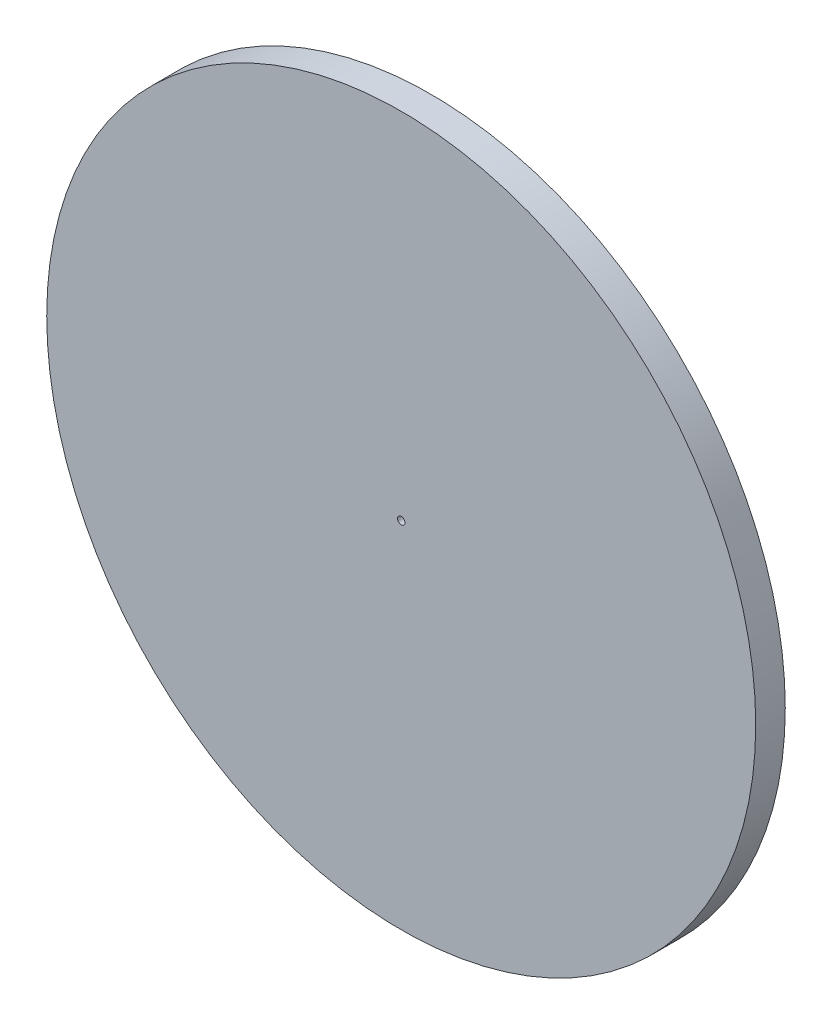
from build123d import *

# Parameters (mm, degrees)
SKETCH1_R           = 152.4
BOSS_EXTRUDE1_DEPTH = 12.7
SKETCH2_R           = 1.5875
CUT_EXTRUDE1_DEPTH  = 216.9


with BuildPart() as part:
    # Sketch1 → Boss-Extrude1 (new body)
    with BuildSketch(Plane.XY):
        Circle(SKETCH1_R)
    extrude(amount=BOSS_EXTRUDE1_DEPTH)

    # Sketch2 → Cut-Extrude1 (cut, through all)
    with BuildSketch(Plane(origin=(0, 0, 0), x_dir=(-1, 0, 0), z_dir=(0, 0, -1))):
        Circle(SKETCH2_R)
    extrude(amount=-CUT_EXTRUDE1_DEPTH, mode=Mode.SUBTRACT)


solid = part.part
